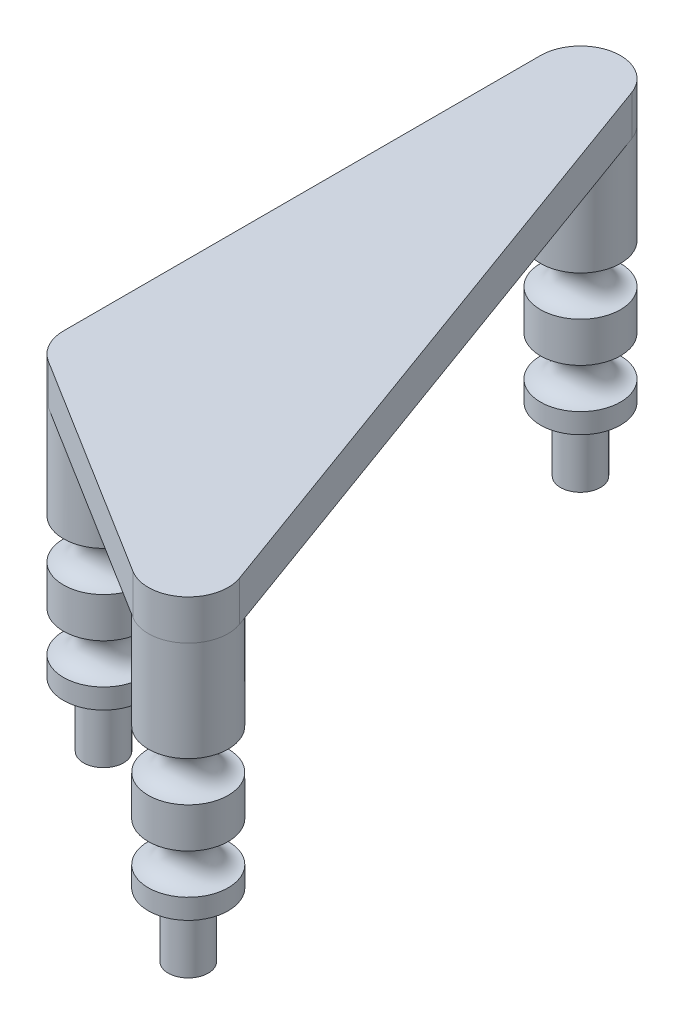
from build123d import *

# Parameters (mm, degrees)
SKETCH1_R           = 6.35
BOSS_EXTRUDE1_DEPTH = 6.35
BOSS_EXTRUDE2_START = -38.1
SKETCH1_4_R         = 6.35
BOSS_EXTRUDE2_DEPTH = 38.1
FILLET1_R           = 6.35
SKETCH3_R           = 3.175
BOSS_EXTRUDE3_DEPTH = 10.16
SKETCH4_R           = 3.175
SKETCH5_R           = 3.175
SKETCH6_R           = 3.175


with BuildPart() as part:
    # Sketch1 → Boss-Extrude1 (new body)
    with BuildSketch(Plane(origin=(0, 0, 0), x_dir=(1, 0, 0), z_dir=(0, 1, 0))):
        with BuildLine():
            Line((30.22676537, -18.817809437), (5.390705766, -3.356008246))
            ThreePointArc((5.390705766, -3.356008246), (1.438748346, -6.184860807), (-3.356008365, -5.390705692))
            Line((-3.356008365, -5.390705692), (32.261462567, -27.564523248))
            ThreePointArc((32.261462567, -27.564523248), (29.432610302, -23.612565912), (30.22676537, -18.817809437))
        make_face()
        with BuildLine():
            ThreePointArc((41.967471135, -22.173817683), (38.700638791, -27.725085755), (32.261462567, -27.564523248))
            Line((32.261462567, -27.564523248), (47.874933198, -37.284759978))
            Line((47.874933198, -37.284759978), (41.584519288, -20.001989801))
            ThreePointArc((41.584519288, -20.001989801), (41.87100037, -21.07115177), (41.967471135, -22.173817683))
        make_face()
        with BuildLine():
            ThreePointArc((6.35, 75.68438), (5.201615481, 72.042169629), (2.17182791, 69.717331858))
            Line((2.17182791, 69.717331858), (33.445643225, -16.206769541))
            ThreePointArc((33.445643225, -16.206769541), (38.301097111, -16.418763242), (41.584519288, -20.001989801))
            Line((41.584519288, -20.001989801), (5.967048123, 77.856207962))
            ThreePointArc((5.967048123, 77.856207962), (6.253529227, 76.787045955), (6.35, 75.68438))
        make_face()
        with BuildLine():
            ThreePointArc((-6.35, 0), (-4.490128061, 4.490128061), (0, 6.35))
            Line((0, 6.35), (0, 69.33438))
            ThreePointArc((0, 69.33438), (-4.490128061, 71.194251939), (-6.35, 75.68438))
            Line((-6.35, 75.68438), (-6.35, 0))
        make_face()
        with BuildLine():
            Line((-6.35, 111.697019555), (-6.35, 75.68438))
            ThreePointArc((-6.35, 75.68438), (-1.102665955, 81.937909227), (5.967048123, 77.856207962))
            Line((5.967048123, 77.856207962), (-6.35, 111.697019555))
        make_face()
        with Locations((35.617471135, -22.173817683)):
            Circle(SKETCH1_R)
        with Locations((0, 75.68438)):
            Circle(SKETCH1_R)
        Circle(SKETCH1_R)
        Polygon((0, 75.68438), (35.617471135, -22.173817683), (0, 0), align=None)
    extrude(amount=BOSS_EXTRUDE1_DEPTH)

    # Sketch1<4> → Boss-Extrude2 (add)
    with BuildSketch(Plane(origin=(0, 0, 0), x_dir=(1, 0, 0), z_dir=(0, 1, 0)).offset(BOSS_EXTRUDE2_START)):
        with Locations(Location((0, 75.68438, 0), (0, 0, 270))):
            Circle(SKETCH1_4_R)
        with Locations(Location((0, 0, 0), (0, 0, 180))):
            Circle(SKETCH1_4_R)
        with Locations(Location((35.617471135, -22.173817683, 0), (0, 0, 270))):
            Circle(SKETCH1_4_R)
    extrude(amount=BOSS_EXTRUDE2_DEPTH)

    # Fillet1
    fillet1_edges = [part.edges().sort_by_distance(p)[0] for p in [
        (47.874933198, 3.175, 37.284759978),
        (-6.35, 3.175, -111.697019555),
    ]]
    fillet(fillet1_edges, radius=FILLET1_R - 0.0001)  # a hair under: the kernel refuses the full size

    # Sketch3 → Boss-Extrude3 (add)
    with BuildSketch(Plane(origin=(0, -38.1, 0), x_dir=(-1, 0, 0), z_dir=(0, -1, 0))):
        with Locations(Location((0, 0, 0), (0, 0, 90))):
            Circle(SKETCH3_R)
        with Locations(Location((-35.617471135, -22.173817683, 0), (0, 0, 90))):
            Circle(SKETCH3_R)
        with Locations(Location((0, 75.68438, 0), (0, 0, 90))):
            Circle(SKETCH3_R)
    extrude(amount=BOSS_EXTRUDE3_DEPTH)

    # Sketch4 → Cut-Revolve1 (revolve, cut)
    with BuildSketch(Plane(origin=(35.617471135, 0, 22.173817683), x_dir=(0, 1, 0), z_dir=(0.8489300418509319, 0, 0.5285052355870989)), mode=Mode.PRIVATE) as cut_revolve1_sk:
        with Locations((-31.75, 6.35)):
            Circle(SKETCH4_R)
        with Locations((-19.05, 6.35)):
            Circle(SKETCH4_R)
    revolve(cut_revolve1_sk.sketch.rotate(Axis((35.617471135, -38.1, 22.173817683), (0, 1, 0)), 31.904515146), axis=Axis((35.617471135, -38.1, 22.173817683), (0, 1, 0)), mode=Mode.SUBTRACT)

    # Sketch5 → Cut-Revolve2 (revolve, cut)
    with BuildSketch(Plane(origin=(0, 0, 0), x_dir=(0, -1, 0), z_dir=(-0.8489300418509319, 0, -0.5285052355870989)), mode=Mode.PRIVATE) as cut_revolve2_sk:
        with Locations((31.75, 6.35)):
            Circle(SKETCH5_R)
        with Locations((19.05, 6.35)):
            Circle(SKETCH5_R)
    revolve(cut_revolve2_sk.sketch.rotate(Axis((0, 6.35, 0), (0, -1, 0)), 328.095484854), axis=Axis((0, 6.35, 0), (0, -1, 0)), mode=Mode.SUBTRACT)

    # Sketch6 → Cut-Revolve3 (revolve, cut)
    with BuildSketch(Plane(origin=(-24.324490855, 0, -66.830989365), x_dir=(0, 1, 0), z_dir=(-0.3420201433256631, 0, -0.9396926207859105)), mode=Mode.PRIVATE) as cut_revolve3_sk:
        with Locations((-31.75, 32.235582495)):
            Circle(SKETCH6_R)
        with Locations((-19.05, 32.235582495)):
            Circle(SKETCH6_R)
    revolve(cut_revolve3_sk.sketch.rotate(Axis((0, -38.1, -75.68438), (0, 1, 0)), 250), axis=Axis((0, -38.1, -75.68438), (0, 1, 0)), mode=Mode.SUBTRACT)


solid = part.part
